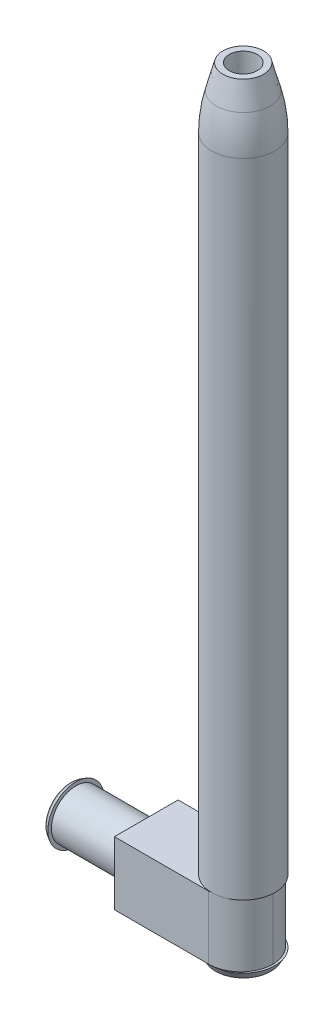
from build123d import *

# Parameters (mm, degrees)
SKETCH2_R           = 4.445
BOSS_EXTRUDE1_DEPTH = 6.35
SKETCH3_R           = 5.08
BOSS_EXTRUDE2_DEPTH = 1.27
BOSS_EXTRUDE2_TAPER = 30
FILLET1_R           = 1.27
SKETCH5_W           = 11.5062
SKETCH5_H           = 11.43
BOSS_EXTRUDE4_DEPTH = 22.86
CUT_EXTRUDE1_REACH  = 33.89
SKETCH6_R           = 2.54
FILLET2_R           = 5.842
SKETCH7_R           = 5.715
BOSS_EXTRUDE5_DEPTH = 1.27
BOSS_EXTRUDE5_TAPER = 30
BOSS_EXTRUDE6_START = 127
SKETCH8_R           = 5.715
SKETCH8_R_2         = 2.54
BOSS_EXTRUDE6_DEPTH = 127
CHAMFER1_SIZE       = 7.62
CHAMFER1_SIZE2      = 2.041772846
FILLET3_R           = 25.4


with BuildPart() as part:
    # Sketch2 → Boss-Extrude1 (new, symmetric)
    with BuildSketch(Plane(origin=(0, 0, 0), x_dir=(0, 0, -1), z_dir=(1, 0, 0))):
        with Locations(Location((0, 0, 0), (0, 0, 180))):
            Circle(SKETCH2_R)
    extrude(amount=BOSS_EXTRUDE1_DEPTH, both=True)

    # Sketch3 → Boss-Extrude2 (add)
    with BuildSketch(Plane.ZY.offset(6.35)):
        Circle(SKETCH3_R)
    extrude(amount=BOSS_EXTRUDE2_DEPTH, taper=BOSS_EXTRUDE2_TAPER)

    # Fillet1
    fillet1_edges = [part.edges().sort_by_distance(p)[0] for p in [
        (-7.62, 0, -4.346765158),
    ]]
    fillet(fillet1_edges, radius=FILLET1_R)

    # Sketch5 → Boss-Extrude4 (add)
    with BuildSketch(Plane(origin=(6.35, 0, 0), x_dir=(0, 0, -1), z_dir=(1, 0, 0))):
        Rectangle(SKETCH5_W, SKETCH5_H)
    extrude(amount=BOSS_EXTRUDE4_DEPTH)

    # Sketch6 → Cut-Extrude1 (cut, up to next)
    with BuildSketch(Plane(origin=(0, 5.715, 0), x_dir=(1, 0, 0), z_dir=(0, 1, 0)), mode=Mode.PRIVATE) as cut_extrude1_sk1:
        with Locations(Location((23.876, 0, 0), (0, 0, 270))):
            Circle(SKETCH6_R)
    cut_extrude1_tool1 = extrude(cut_extrude1_sk1.sketch, amount=-CUT_EXTRUDE1_REACH, mode=Mode.PRIVATE) & part.part
    add(cut_extrude1_tool1.solids().sort_by_distance((23.876, 5.715, 0))[0], mode=Mode.SUBTRACT)

    # Fillet2
    # the kernel refuses this fillet: 5.842 mm, written as the material it takes off along each edge
    with BuildSketch(Plane(origin=(29.21, -20.32, -5.7531), x_dir=(0, 0, 1), z_dir=(0, 1, 0))) as fillet2_piece_1:
        with BuildLine():
            CenterArc((FILLET2_R, -FILLET2_R), FILLET2_R, 90, 90)
            Line((0, -FILLET2_R), (0, 0))
            Line((0, 0), (FILLET2_R, 0))
        make_face()
    extrude(amount=40.64, mode=Mode.SUBTRACT)
    with BuildSketch(Plane(origin=(29.21, 20.32, 5.7531), x_dir=(-1, 0, 0), z_dir=(0, -1, 0))) as fillet2_piece_2:
        with BuildLine():
            CenterArc((FILLET2_R, FILLET2_R), FILLET2_R, 180, 90)
            Line((0, FILLET2_R), (0, 0))
            Line((0, 0), (FILLET2_R, 0))
        make_face()
    extrude(amount=40.64, mode=Mode.SUBTRACT)

    # Sketch7 → Boss-Extrude5 (add)
    with BuildSketch(Plane.XZ.offset(5.715)):
        with Locations((23.876, 0)):
            Circle(SKETCH7_R)
    extrude(amount=BOSS_EXTRUDE5_DEPTH, taper=BOSS_EXTRUDE5_TAPER)

    # Sketch8 → Boss-Extrude6 (add)
    with BuildSketch(Plane(origin=(0, 5.715, 0), x_dir=(1, 0, 0), z_dir=(0, 1, 0)).offset(BOSS_EXTRUDE6_START)):
        with Locations(Location((23.876, 0, 0), (0, 0, 88.162656718))):
            Circle(SKETCH8_R)
        with Locations(Location((23.876, 0, 0), (0, 0, 270))):
            Circle(SKETCH8_R_2, mode=Mode.SUBTRACT)
    extrude(amount=-BOSS_EXTRUDE6_DEPTH)

    # Chamfer1
    chamfer1_edges = [part.edges().sort_by_distance(p)[0] for p in [
        (23.692764561, 132.715, 5.71206178),
    ]]
    chamfer1_side = [part.faces().sort_by_distance(p)[0] for p in [
        (23.692764561, 69.215, 5.71206178),
    ]]
    chamfer(chamfer1_edges, length=CHAMFER1_SIZE, length2=CHAMFER1_SIZE2, reference=chamfer1_side[0])

    # Fillet3
    fillet3_edges = [part.edges().sort_by_distance(p)[0] for p in [
        (23.692764561, 125.095, 5.71206178),
    ]]
    fillet(fillet3_edges, radius=FILLET3_R)


solid = part.part
